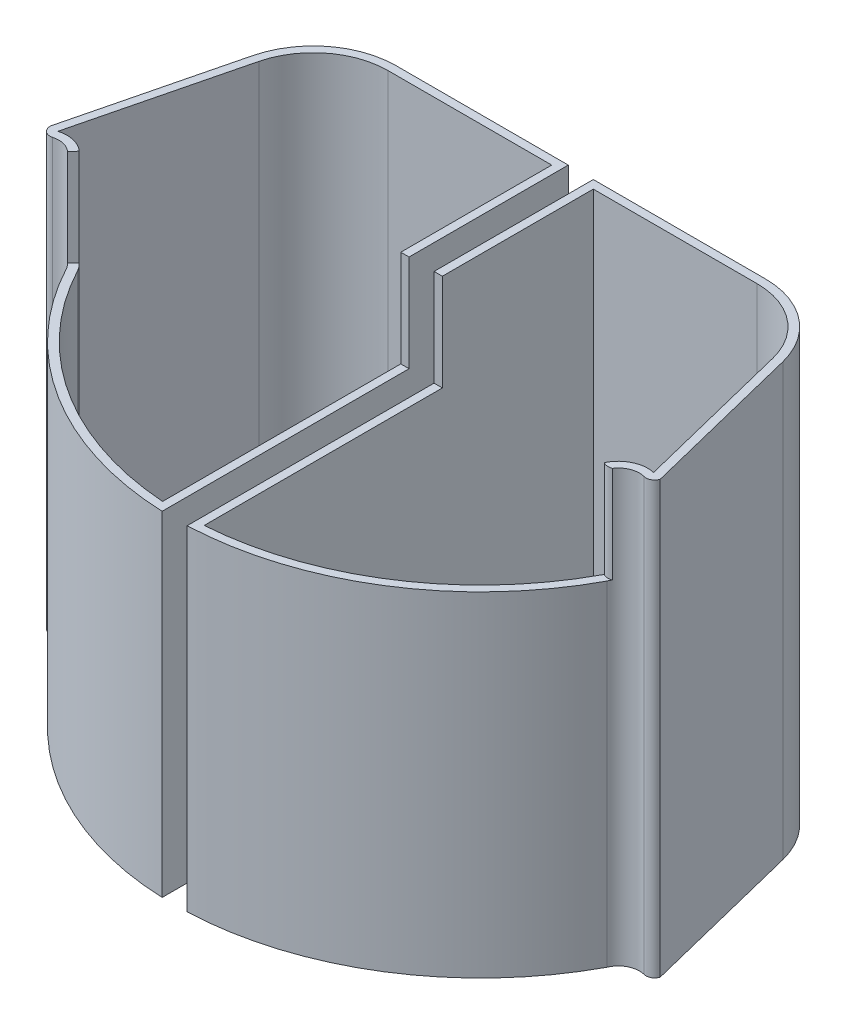
from build123d import *

# Parameters (mm, degrees)
SKETCH_1_W          = 300
SKETCH_1_H          = 250
EXTRUDE_1_DEPTH     = 3
SKETCH_2_W          = 300
SKETCH_2_H          = 250
CUT_EXTRUDE_1_DEPTH = 3
EXTRUDE_2_DEPTH     = 153
CUT_EXTRUDE_START   = -35
CUT_EXTRUDE_2_DEPTH = 35
CUT_EXTRUDE_START_2 = -10
CUT_EXTRUDE_3_DEPTH = 10
SHELL_START         = 3
SHELL_1_DEPTH       = 153
SHELL_START_2       = 121
SHELL_1_2_DEPTH     = 35
SHELL_2_T           = -3


# Read off the part's stored shape, not the designer's step: 抽壳1
with BuildPart() as part:
    # 草图1 → 凸台-拉伸1 (new body)
    with BuildSketch(Plane(origin=(0, 0, 0), x_dir=(1, 0, 0), z_dir=(0, 1, 0))):
        Rectangle(SKETCH_1_W, SKETCH_1_H)
    extrude(amount=EXTRUDE_1_DEPTH)

    # 草图2 → 切除-拉伸1 (cut)
    with BuildSketch(Plane.XZ):
        Rectangle(SKETCH_2_W, SKETCH_2_H)
        with BuildLine():
            Line((-96.034128138, -70.479858108), (-110.443017753, -12.373184121))
            ThreePointArc((-110.443017753, -12.373184121), (-109.607353553, -9.431300157), (-106.647480506, -8.661775979))
            ThreePointArc((-106.647480506, -8.661775979), (-101.61443354, -8.303527417), (-97.902413518, -4.885807248))
            ThreePointArc((-97.902413518, -4.885807248), (-0.135427504, 53.764212837), (97.631558511, -4.885807248))
            ThreePointArc((97.631558511, -4.885807248), (101.296546617, -8.843997431), (106.662783622, -9.394367981))
            ThreePointArc((106.662783622, -9.394367981), (108.948530847, -9.681339358), (110.395076199, -11.474241892))
            Line((110.395076199, -11.474241892), (95.763273131, -70.479858108))
            ThreePointArc((95.763273131, -70.479858108), (85.13008753, -86.887885102), (66.645163907, -93.259351533))
            Line((66.645163907, -93.259351533), (-66.916018914, -93.259351533))
            ThreePointArc((-66.916018914, -93.259351533), (-85.400942538, -86.887885102), (-96.034128138, -70.479858108))
        make_face(mode=Mode.SUBTRACT)
    extrude(amount=-CUT_EXTRUDE_1_DEPTH, mode=Mode.SUBTRACT)

    # 草图3 → 凸台-拉伸2 (add)
    with BuildSketch(Plane(origin=(0, 3, 0), x_dir=(1, 0, 0), z_dir=(0, 1, 0))):
        with BuildLine():
            Line((4.387708898, 93.259351533), (4.387708898, -53.671861104))
            ThreePointArc((4.387708898, -53.671861104), (58.797308872, -36.793671157), (97.631558511, 4.885807248))
            ThreePointArc((97.631558511, 4.885807248), (101.296546617, 8.843997431), (106.662783622, 9.394367981))
            ThreePointArc((106.662783622, 9.394367981), (108.948530847, 9.681339358), (110.395076199, 11.474241892))
            Line((110.395076199, 11.474241892), (95.763273131, 70.479858108))
            ThreePointArc((95.763273131, 70.479858108), (85.13008753, 86.887885102), (66.645163907, 93.259351533))
            Line((66.645163907, 93.259351533), (4.387708898, 93.259351533))
        make_face()
        with BuildLine():
            Line((-4.658563905, 93.259351533), (-4.658563905, -53.671861104))
            ThreePointArc((-4.658563905, -53.671861104), (-59.068163879, -36.793671157), (-97.902413518, 4.885807248))
            ThreePointArc((-97.902413518, 4.885807248), (-101.61443354, 8.303527417), (-106.647480506, 8.661775979))
            ThreePointArc((-106.647480506, 8.661775979), (-109.607353553, 9.431300157), (-110.443017753, 12.373184121))
            Line((-110.443017753, 12.373184121), (-96.034128138, 70.479858108))
            ThreePointArc((-96.034128138, 70.479858108), (-85.400942538, 86.887885102), (-66.916018914, 93.259351533))
            Line((-66.916018914, 93.259351533), (-4.658563905, 93.259351533))
        make_face()
    extrude(amount=EXTRUDE_2_DEPTH)

    # 草图4 → 切除-拉伸2 (cut)
    with BuildSketch(Plane(origin=(0, 156, 0), x_dir=(1, 0, 0), z_dir=(0, 1, 0)).offset(CUT_EXTRUDE_START)):
        with BuildLine():
            ThreePointArc((-90.555079263, 35.658474468), (-92.886476686, 22.794388775), (-93.396966674, 9.730717216))
            ThreePointArc((-93.396966674, 9.730717216), (-95.515099044, 6.310295135), (-99.490206151, 6.930210805))
            ThreePointArc((-99.490206151, 6.930210805), (-98.6090935, 5.975745875), (-97.902413518, 4.885807248))
            ThreePointArc((-97.902413518, 4.885807248), (-95.111575936, -0.038030653), (-92.072972831, -4.812949003))
            ThreePointArc((-92.072972831, -4.812949003), (-0.301965438, -80.948973345), (91.739456293, -5.140077521))
            Line((91.739456293, -5.140077521), (92.072972831, -4.812949003))
            ThreePointArc((92.072972831, -4.812949003), (94.500577424, -1.042475314), (96.773639732, 2.823132484))
            Line((96.773639732, 2.823132484), (98.387480713, 3.000917932))
            Line((98.387480713, 3.000917932), (98.675419823, 6.368186048))
            ThreePointArc((98.675419823, 6.368186048), (95.079526349, 6.547689669), (93.396966674, 9.730717216))
            ThreePointArc((93.39696666, 9.730717216), (92.888027795, 22.793796517), (90.563566393, 35.658474468))
            Line((90.563566393, 35.658474468), (-90.555079263, 35.658474468))
        make_face()
    extrude(amount=CUT_EXTRUDE_2_DEPTH, mode=Mode.SUBTRACT)

    # 草图5 → 切除-拉伸3 (cut)
    with BuildSketch(Plane(origin=(0, 3, 0), x_dir=(1, 0, 0), z_dir=(0, 1, 0)).offset(CUT_EXTRUDE_START_2)):
        with BuildLine():
            Line((4.387708898, 93.259351533), (-4.658563905, 93.259351533))
            Line((-4.658563905, 93.259351533), (-4.658563905, -53.671861104))
            ThreePointArc((-4.658563905, -53.671861104), (-0.135427504, -53.764212837), (4.387708898, -53.671861104))
            Line((4.387708898, -53.671861104), (4.387708898, 93.259351533))
        make_face()
    extrude(amount=CUT_EXTRUDE_3_DEPTH, mode=Mode.SUBTRACT)


with BuildPart() as cut_extrude_3_piece_1:
    # of the separate pieces the step leaves, piece 1, a body of its own (cut_extrude_3_pieces)
    add(part.part.solids().sort_by_distance((-4.658563905, 0, -93.259351533))[0])

    # 抽壳1 outline → 抽壳1 (cut)
    with BuildSketch(Plane(origin=(0, 0, 0), x_dir=(1, 0, 0), z_dir=(0, 1, 0)).offset(SHELL_START)):
        with BuildLine():
            ThreePointArc((-107.434605996, 11.556673813), (-100.425207833, 11.057750032), (-95.255570732, 6.29797695))
            ThreePointArc((-95.255570732, 6.29797695), (-58.790804671, -33.411934048), (-7.658563905, -50.501408869))
            Line((-7.658563905, -50.501408869), (-7.658563905, 90.259351533))
            Line((-7.658563905, 90.259351533), (-66.916018914, 90.259351533))
            ThreePointArc((-66.916018914, 90.259351533), (-83.552450175, 84.525031745), (-93.122317216, 69.75780745))
            Line((-93.122317216, 69.75780745), (-107.53120683, 11.651133463))
            ThreePointArc((-107.53120683, 11.651133463), (-107.509938205, 11.576259097), (-107.434605996, 11.556673813))
        make_face()
    extrude(amount=SHELL_1_DEPTH, mode=Mode.SUBTRACT)

    # Shell 1 2 outline → Shell 1 2 (cut)
    with BuildSketch(Plane(origin=(0, 0, 0), x_dir=(1, 0, 0), z_dir=(0, 1, 0)).offset(SHELL_START_2)):
        with BuildLine():
            Line((-97.466849673, 9.145166462), (-99.490206151, 6.930210805))
            ThreePointArc((-99.490206151, 6.930210805), (-97.485888684, 6.005700415), (-95.315849702, 6.409357179))
            ThreePointArc((-95.315849702, 6.409357179), (-96.278736414, 7.865802769), (-97.466849673, 9.145166462))
        make_face()
    extrude(amount=SHELL_1_2_DEPTH, mode=Mode.SUBTRACT)


with BuildPart() as cut_extrude_3_piece_2:
    # of the separate pieces the step leaves, piece 2, a body of its own (cut_extrude_3_pieces)
    add(part.part.solids().sort_by_distance((97.631558511, 0, -4.885807248))[0])

    # 抽壳2
    shell_2_openings = [cut_extrude_3_piece_2.faces().sort_by_distance(p)[0] for p in [
        (44.084656867, 121, 2.602080158),
        (94.9240226, 138.5, -6.652476848),
        (53.824283393, 156, -60.175200574),
        (92.888027795, 138.5, -22.793796517),
        (47.475637646, 138.5, -35.658474468),
    ]]
    offset(amount=SHELL_2_T, openings=shell_2_openings, kind=Kind.INTERSECTION)


solid = Compound([cut_extrude_3_piece_1.part, cut_extrude_3_piece_2.part])
